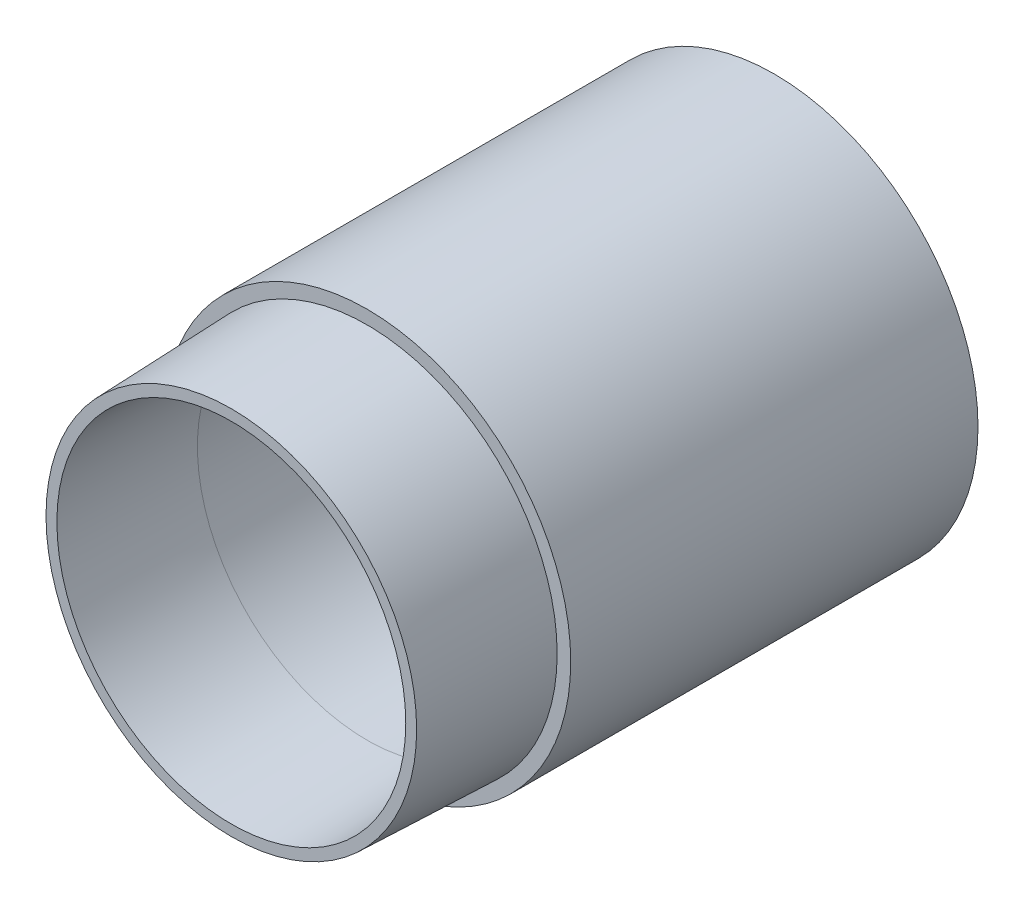
from build123d import *

# Parameters (mm, degrees)
CROQUIS1_R                        = 15
CROQUIS1_R_2                      = 14
SALIENTE_EXTRUIR1_DEPTH           = 30
CROQUIS2_R                        = 14
CROQUIS2_R_2                      = 12.5
SALIENTE_EXTRUIR2_DEPTH           = 10
SALIENTE_EXTRUIR2_TAPER           = 2
SALIENTE_EXTRUIR2_OTHER_WAY_DEPTH = 10


with BuildPart() as part:
    # Croquis1 → Saliente-Extruir1 (new body)
    with BuildSketch(Plane.XY):
        Circle(CROQUIS1_R)
        Circle(CROQUIS1_R_2, mode=Mode.SUBTRACT)
    extrude(amount=SALIENTE_EXTRUIR1_DEPTH)

    # Croquis2 → Saliente-Extruir2 (add)
    with BuildSketch(Plane.XY.offset(30)):
        Circle(CROQUIS2_R)
        Circle(CROQUIS2_R_2, mode=Mode.SUBTRACT)
    extrude(amount=SALIENTE_EXTRUIR2_DEPTH, taper=SALIENTE_EXTRUIR2_TAPER)

    # Croquis2 → Saliente-Extruir2 other way (add)
    with BuildSketch(Plane.XY.offset(30)):
        Circle(CROQUIS2_R)
        Circle(CROQUIS2_R_2, mode=Mode.SUBTRACT)
    extrude(amount=-SALIENTE_EXTRUIR2_OTHER_WAY_DEPTH)


solid = part.part
